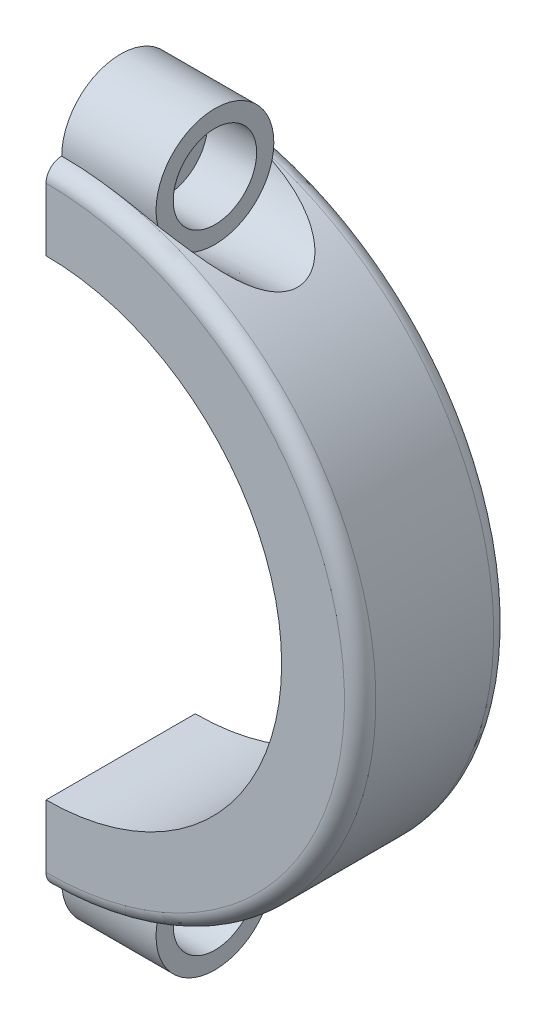
from build123d import *

# Parameters (mm, degrees)
BOSS_EXTRUDE1_DEPTH                               = 24.13
SKETCH2_R                                         = 9.525
BOSS_EXTRUDE2_DEPTH                               = 15.25
CUT_EXTRUDE1_START                                = -15.25
SKETCH2_3_R                                       = 9.525
CUT_EXTRUDE1_DEPTH                                = 15.25
CUT_EXTRUDE1_DRAFT                                = -3
CBORE_FOR_5_16_SOCKET_HEAD_CAP_SCREW2_D           = 8.4328
CBORE_FOR_5_16_SOCKET_HEAD_CAP_SCREW2_CBORE_D     = 13.49502
CBORE_FOR_5_16_SOCKET_HEAD_CAP_SCREW2_CBORE_DEPTH = 7.9375
MIRROR1_START                                     = -15.25
MIRROR1_COPY_1_SKETCH_R                           = 9.525
MIRROR1_COPY_1_DEPTH                              = 15.25
MIRROR1_COPY_1_DRAFT                              = -3
FILLET1_R                                         = 2.54


with BuildPart() as part:
    # Sketch1 → Boss-Extrude1 (new body)
    with BuildSketch(Plane.XY):
        with BuildLine():
            Line((0, 50.8), (0, 38.1))
            ThreePointArc((0, 38.1), (38.1, 0), (0, -38.1))
            Line((0, -38.1), (0, -50.8))
            ThreePointArc((0, -50.8), (50.8, 0), (0, 50.8))
        make_face()
    extrude(amount=BOSS_EXTRUDE1_DEPTH)

    # Sketch2 → Boss-Extrude2 (add)
    with BuildSketch(Plane.ZY):
        with Locations((12.065, -50.8)):
            Circle(SKETCH2_R)
    boss_extrude2 = extrude(amount=-BOSS_EXTRUDE2_DEPTH)


with BuildPart() as cut_extrude1_tool:
    # Sketch2<3> → Cut-Extrude1 (with draft: the straight prism first)
    with BuildSketch(Plane.ZY.offset(CUT_EXTRUDE1_START)):
        with Locations((12.065, -50.8)):
            Circle(SKETCH2_3_R)
    extrude(amount=-CUT_EXTRUDE1_DEPTH)
    # Cut-Extrude1: the draft: its side faces are tilted about the plane it starts from
    cut_extrude1_sides = [cut_extrude1_tool.faces().sort_by_distance(p)[0] for p in [
        (22.875, -50.8, 2.54),
    ]]
    draft(cut_extrude1_sides, Plane.ZY.offset(CUT_EXTRUDE1_START), CUT_EXTRUDE1_DRAFT)


with BuildPart() as part_1:
    add(part.part)

    # Cut-Extrude1: cut by cut_extrude1_tool
    add(cut_extrude1_tool.part, mode=Mode.SUBTRACT)

    # CBORE for 5/16 Socket Head Cap Screw2 (through all)
    with Locations(Plane(origin=(15.25, -50.8, 12.065), x_dir=(0, 0, 1), z_dir=(1, 0, 0))):
        with Locations((0, 0)):
            cbore_for_5_16_socket_head_cap_screw2 = CounterBoreHole(CBORE_FOR_5_16_SOCKET_HEAD_CAP_SCREW2_D / 2, CBORE_FOR_5_16_SOCKET_HEAD_CAP_SCREW2_CBORE_D / 2, CBORE_FOR_5_16_SOCKET_HEAD_CAP_SCREW2_CBORE_DEPTH)

    # Mirror1: Boss-Extrude2, CBORE for 5/16 Socket Head Cap Screw2 across plane
    add(boss_extrude2.mirror(Plane.ZX))
    add(cbore_for_5_16_socket_head_cap_screw2.mirror(Plane.ZX), mode=Mode.SUBTRACT)


with BuildPart() as mirror1_copy_1_tool:
    # Mirror1 copy 1 sketch → Mirror1 copy 1 (with draft: the straight prism first)
    with BuildSketch(Plane.ZY.offset(MIRROR1_START)):
        with Locations((12.065, 50.8)):
            Circle(MIRROR1_COPY_1_SKETCH_R)
    extrude(amount=-MIRROR1_COPY_1_DEPTH)
    # Mirror1 copy 1: the draft: its side faces are tilted about the plane it starts from
    mirror1_copy_1_sides = [mirror1_copy_1_tool.faces().sort_by_distance(p)[0] for p in [
        (22.875, 50.8, 2.54),
    ]]
    draft(mirror1_copy_1_sides, Plane.ZY.offset(MIRROR1_START), MIRROR1_COPY_1_DRAFT)


with BuildPart() as part_2:
    add(part_1.part)

    # Mirror1 copy 1: cut by mirror1_copy_1_tool
    add(mirror1_copy_1_tool.part, mode=Mode.SUBTRACT)

    # Fillet1
    fillet1_edges = [part_2.edges().sort_by_distance(p)[0] for p in [
        (50.8, 0, 24.13),
        (50.8, 0, 0),
    ]]
    fillet(fillet1_edges, radius=FILLET1_R - 0.0001)  # a hair under: the kernel refuses the full size


solid = part_2.part
